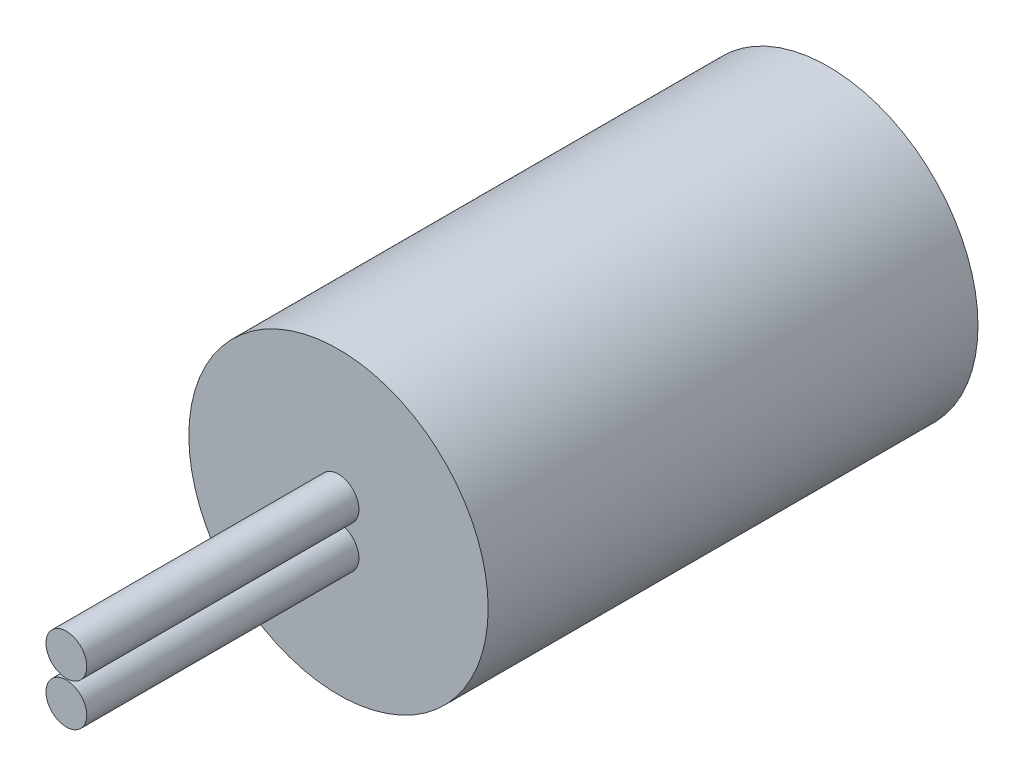
from build123d import *

# Parameters (mm, degrees)
SKETCH_1_R        = 5.5
EXTRUDE_312_DEPTH = 9
SKETCH_2_R        = 0.75
EXTRUDE_526_DEPTH = 10


with BuildPart() as part:
    # Эскиз1 → Extrude 312 (new, symmetric)
    with BuildSketch(Plane.XY):
        Circle(SKETCH_1_R)
    extrude(amount=EXTRUDE_312_DEPTH, both=True)

    # Эскиз2 → Extrude 526 (add)
    with BuildSketch(Plane.XY.offset(9)):
        with Locations((0, -0.775)):
            Circle(SKETCH_2_R)
        with Locations((0, 0.775)):
            Circle(SKETCH_2_R)
    extrude(amount=EXTRUDE_526_DEPTH)


solid = part.part
